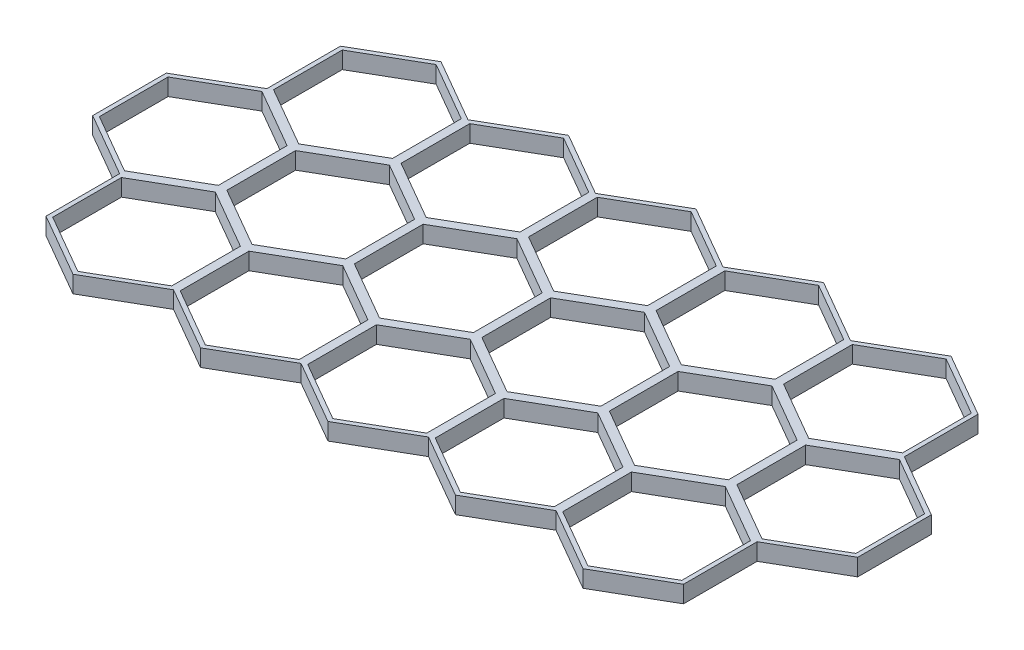
from build123d import *

# Parameters (mm, degrees)
BOSS_EXTRUDE1_DEPTH = 2


with BuildPart() as part:
    # Sketch1 → Boss-Extrude1 (new body)
    with BuildSketch(Plane(origin=(0, 0, 0), x_dir=(1, 0, 0), z_dir=(0, 1, 0))):
        Polygon((7.5, 4.330127019), (0, 8.660254038), (-7.5, 4.330127019), (-7.5, -4.330127019), (-15, -8.660254038), (-15, -17.320508076), (-7.5, -21.650635095), (-7.5, -30.310889132), (0, -34.641016151), (7.5, -30.310889132), (15, -34.641016151), (22.5, -30.310889132), (30, -34.641016151), (37.5, -30.310889132), (45, -34.641016151), (52.5, -30.310889132), (60, -34.641016151), (67.5, -30.310889132), (67.5, -21.650635095), (75, -17.320508076), (75, -8.660254038), (67.5, -4.330127019), (67.5, 4.330127019), (60, 8.660254038), (52.5, 4.330127019), (45, 8.660254038), (37.5, 4.330127019), (30, 8.660254038), (22.5, 4.330127019), (15, 8.660254038), align=None)
        Polygon((-7, 4.041451884), (0, 8.082903769), (7, 4.041451884), (7, -4.041451884), (0, -8.082903769), (-7, -4.041451884), align=None, mode=Mode.SUBTRACT)
        Polygon((15, 8.082903769), (22, 4.041451884), (22, -4.041451884), (15, -8.082903769), (8, -4.041451884), (8, 4.041451884), align=None, mode=Mode.SUBTRACT)
        Polygon((14.5, -8.948929172), (14.5, -17.031832941), (7.5, -21.073284825), (0.5, -17.031832941), (0.5, -8.948929172), (7.5, -4.907477288), align=None, mode=Mode.SUBTRACT)
        Polygon((-7.5, -4.907477288), (-0.5, -8.948929172), (-0.5, -17.031832941), (-7.5, -21.073284825), (-14.5, -17.031832941), (-14.5, -8.948929172), align=None, mode=Mode.SUBTRACT)
        Polygon((30, 8.082903769), (37, 4.041451884), (37, -4.041451884), (30, -8.082903769), (23, -4.041451884), (23, 4.041451884), align=None, mode=Mode.SUBTRACT)
        Polygon((22.5, -4.907477288), (29.5, -8.948929172), (29.5, -17.031832941), (22.5, -21.073284825), (15.5, -17.031832941), (15.5, -8.948929172), align=None, mode=Mode.SUBTRACT)
        Polygon((15, -34.063665882), (8, -30.022213998), (8, -21.939310229), (15, -17.897858345), (22, -21.939310229), (22, -30.022213998), align=None, mode=Mode.SUBTRACT)
        Polygon((7, -30.022213998), (0, -34.063665882), (-7, -30.022213998), (-7, -21.939310229), (0, -17.897858345), (7, -21.939310229), align=None, mode=Mode.SUBTRACT)
        Polygon((45, 8.082903769), (52, 4.041451884), (52, -4.041451884), (45, -8.082903769), (38, -4.041451884), (38, 4.041451884), align=None, mode=Mode.SUBTRACT)
        Polygon((37.5, -4.907477288), (44.5, -8.948929172), (44.5, -17.031832941), (37.5, -21.073284825), (30.5, -17.031832941), (30.5, -8.948929172), align=None, mode=Mode.SUBTRACT)
        Polygon((37, -30.022213998), (30, -34.063665882), (23, -30.022213998), (23, -21.939310229), (30, -17.897858345), (37, -21.939310229), align=None, mode=Mode.SUBTRACT)
        Polygon((60, 8.082903769), (67, 4.041451884), (67, -4.041451884), (60, -8.082903769), (53, -4.041451884), (53, 4.041451884), align=None, mode=Mode.SUBTRACT)
        Polygon((52.5, -4.907477288), (59.5, -8.948929172), (59.5, -17.031832941), (52.5, -21.073284825), (45.5, -17.031832941), (45.5, -8.948929172), align=None, mode=Mode.SUBTRACT)
        Polygon((52, -30.022213998), (45, -34.063665882), (38, -30.022213998), (38, -21.939310229), (45, -17.897858345), (52, -21.939310229), align=None, mode=Mode.SUBTRACT)
        Polygon((67.5, -4.907477288), (74.5, -8.948929172), (74.5, -17.031832941), (67.5, -21.073284825), (60.5, -17.031832941), (60.5, -8.948929172), align=None, mode=Mode.SUBTRACT)
        Polygon((67, -30.022213998), (60, -34.063665882), (53, -30.022213998), (53, -21.939310229), (60, -17.897858345), (67, -21.939310229), align=None, mode=Mode.SUBTRACT)
    extrude(amount=BOSS_EXTRUDE1_DEPTH)


solid = part.part
